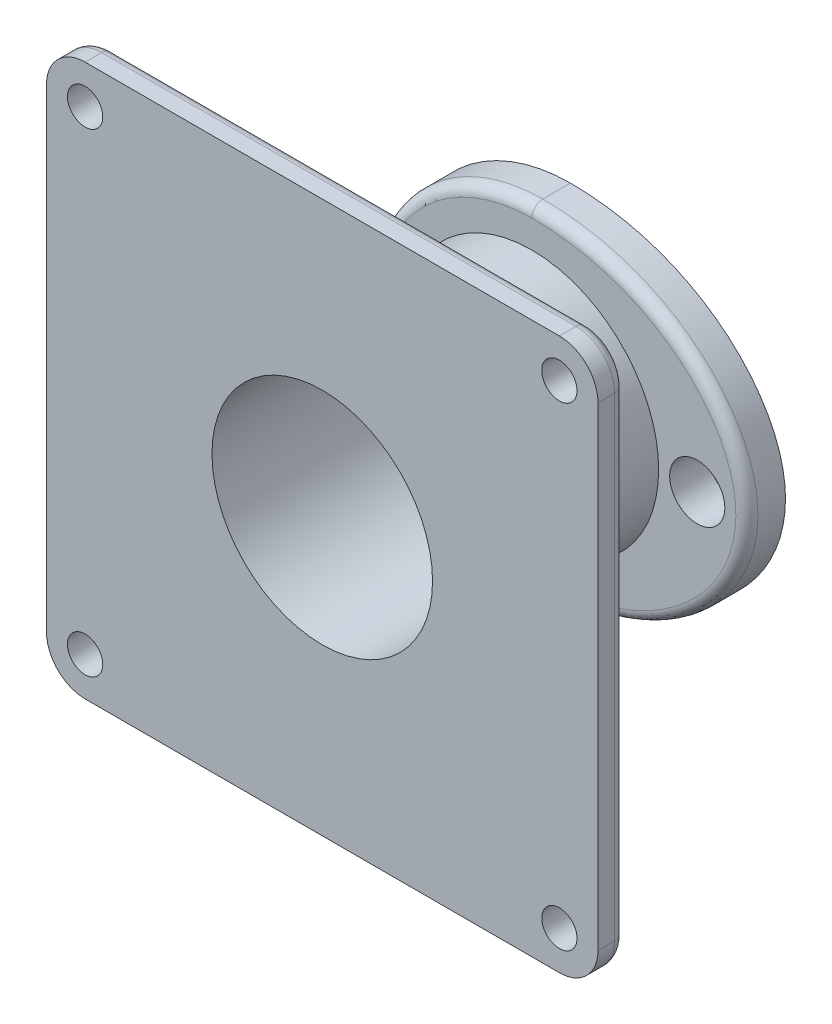
from build123d import *

# Parameters (mm, degrees)
BOSS_EXTRUDE1_OUTLINE_R   = 10
BOSS_EXTRUDE1_OUTLINE_R_2 = 2.5
BOSS_EXTRUDE1_DEPTH       = 3.5
SKETCH1_3_R               = 11.5
SKETCH1_3_R_2             = 10
BOSS_EXTRUDE2_DEPTH       = 20
SKETCH2_W                 = 50
SKETCH2_H                 = 50
SKETCH2_R                 = 1.6
SKETCH2_R_2               = 11.5
SKETCH2_R_3               = 10
BOSS_EXTRUDE3_DEPTH       = 2.5
FILLET1_R                 = 3.5
FILLET2_R                 = 5
FILLET3_R                 = 1


# Read off the part's stored shape, not the designer's step: Boss-Extrude1
with BuildPart() as part:
    # Boss-Extrude1 outline → Boss-Extrude1 (new body)
    with BuildSketch(Plane.XY):
        with BuildLine():
            ThreePointArc((0, 15), (-15, 0), (0, -15))
            add(Edge.make_bspline(
                [(0, -15), (11.666666667, -15), (19.5, -7.666459565), (19.5, 7.333540435), (11.666666667, 15), (0, 15)],
                knots=[0, 0, 0, 0, 0.511097304, 0.511097304, 1, 1, 1, 1], degree=3))
        make_face()
        Circle(BOSS_EXTRUDE1_OUTLINE_R, mode=Mode.SUBTRACT)
        with Locations((15, 0)):
            Circle(BOSS_EXTRUDE1_OUTLINE_R_2, mode=Mode.SUBTRACT)
    extrude(amount=BOSS_EXTRUDE1_DEPTH)

    # Sketch1<3> → Boss-Extrude2 (add)
    with BuildSketch(Plane.XY):
        Circle(SKETCH1_3_R)
        Circle(SKETCH1_3_R_2, mode=Mode.SUBTRACT)
    extrude(amount=BOSS_EXTRUDE2_DEPTH)

    # Sketch2 → Boss-Extrude3 (add)
    # profile 1 of 2: a face of its own
    with BuildSketch(Plane.XY.offset(20)):
        Rectangle(SKETCH2_W, SKETCH2_H)
        with Locations((21.5, 21.5)):
            Circle(SKETCH2_R, mode=Mode.SUBTRACT)
        with Locations((21.5, -21.5)):
            Circle(SKETCH2_R, mode=Mode.SUBTRACT)
        with Locations((-21.5, -21.5)):
            Circle(SKETCH2_R, mode=Mode.SUBTRACT)
        with Locations((-21.5, 21.5)):
            Circle(SKETCH2_R, mode=Mode.SUBTRACT)
        Circle(SKETCH2_R_2, mode=Mode.SUBTRACT)
    # profile 2 of 2: a face of its own
    with BuildSketch(Plane.XY.offset(20)):
        Circle(SKETCH2_R_2)
        Circle(SKETCH2_R_3, mode=Mode.SUBTRACT)
    extrude(amount=BOSS_EXTRUDE3_DEPTH)

    # Fillet1
    fillet1_edges = [part.edges().sort_by_distance(p)[0] for p in [
        (25, -25, 21.25),
        (25, 25, 21.25),
        (-25, 25, 21.25),
        (-25, -25, 21.25),
    ]]
    fillet(fillet1_edges, radius=FILLET1_R)

    # Fillet2
    fillet2_edges = [part.edges().sort_by_distance(p)[0] for p in [
        (-11.5, 0, 20),
    ]]
    fillet(fillet2_edges, radius=FILLET2_R)

    # Fillet3
    fillet3_edges = [part.edges().sort_by_distance(p)[0] for p in [
        (-15, 0, 3.5),
        (25, 0, 20),
        (0, -25, 20),
        (-25, 0, 20),
        (0, 25, 20),
        (23.974873734, 23.974873734, 20),
        (-23.974873734, 23.974873734, 20),
        (-23.974873734, -23.974873734, 20),
        (23.974873734, -23.974873734, 20),
        (10, 0, 11.25),
    ]]
    fillet(fillet3_edges, radius=FILLET3_R)


solid = part.part
